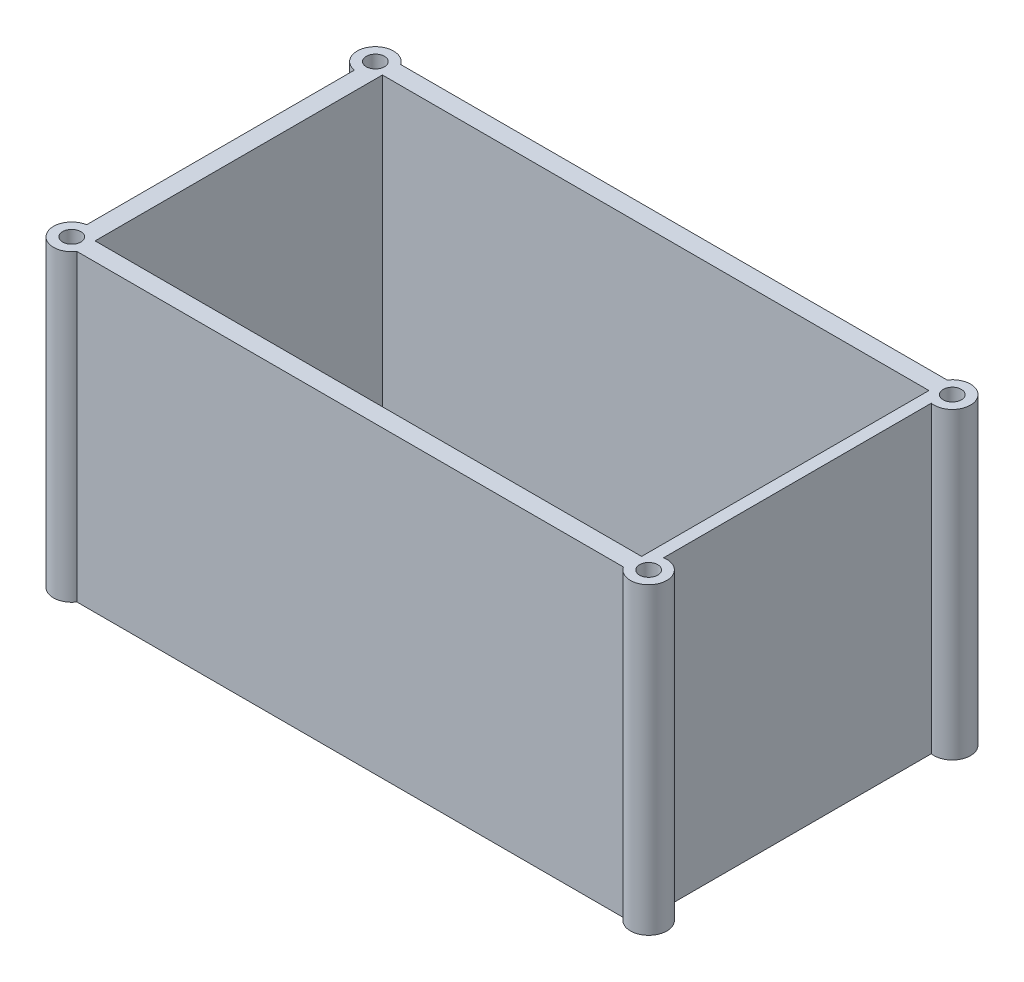
from build123d import *

# Parameters (mm, degrees)
SKETCH1_R           = 1.5
SKETCH1_W           = 90
SKETCH1_H           = 47.31662479
BOSS_EXTRUDE1_DEPTH = 50


with BuildPart() as part:
    # Sketch1 → Boss-Extrude1 (new body)
    with BuildSketch(Plane(origin=(0, 0, 0), x_dir=(1, 0, 0), z_dir=(0, 1, 0))):
        with BuildLine():
            Line((-45, 26.658312395), (45, 26.658312395))
            ThreePointArc((45, 26.658312395), (50.252758091, 26.192611794), (47, 22.041960108))
            Line((47, 22.041960108), (47, -22.041960108))
            ThreePointArc((47, -22.041960108), (50.252758091, -26.192611794), (45, -26.658312395))
            Line((45, -26.658312395), (-45, -26.658312395))
            ThreePointArc((-45, -26.658312395), (-50.01548745, -26.634724102), (-48, -22.041960108))
            Line((-48, -22.041960108), (-48, 22.041960108))
            ThreePointArc((-48, 22.041960108), (-50.01548745, 26.634724102), (-45, 26.658312395))
        make_face()
        with Locations((47.5, -25)):
            Circle(SKETCH1_R, mode=Mode.SUBTRACT)
        with Locations((-47.5, -25)):
            Circle(SKETCH1_R, mode=Mode.SUBTRACT)
        with Locations((47.5, 25)):
            Circle(SKETCH1_R, mode=Mode.SUBTRACT)
        with Locations((-47.5, 25)):
            Circle(SKETCH1_R, mode=Mode.SUBTRACT)
        Rectangle(SKETCH1_W, SKETCH1_H, mode=Mode.SUBTRACT)
    extrude(amount=BOSS_EXTRUDE1_DEPTH)


solid = part.part
